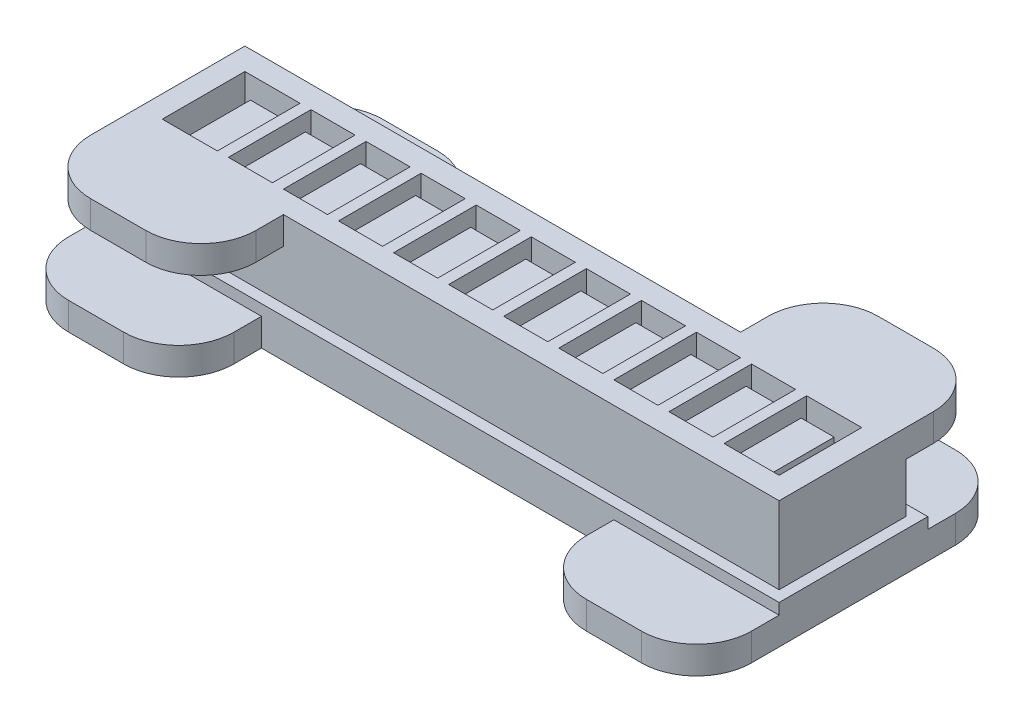
from build123d import *

# Parameters (mm, degrees)
SKETCH1_W                    = 8
SKETCH1_H                    = 15
FIRST_CHAMBER_BLOCK_DEPTH    = 15
SKETCH2_W                    = 6
SKETCH2_H                    = 11
FIRST_CHAMBER_CAVITY_DEPTH   = 13
SKETCH3_W                    = 15
SKETCH3_H                    = 3
CHAMBER_SPACER_DEPTH         = 2
PATTERN_CHAMBERS_COUNT       = 11
PATTERN_CHAMBERS_PITCH       = 10
SKETCH4_W                    = 15
SKETCH4_H                    = 12
THICKEN_END_1_DEPTH          = 2
SKETCH5_W                    = 15
SKETCH5_H                    = 15
THICKEN_END_2_DEPTH          = 2
SKETCH6_W                    = 94
SKETCH6_H                    = 2
CENTRAL_AIR_CHANNEL_DEPTH    = 2
SKETCH7_W                    = 108
SKETCH7_H                    = 13
SKETCH7_W_2                  = 106
SKETCH7_H_2                  = 11
BONDING_RIDGE_DEPTH          = 2
SKETCH9_W                    = 2
SKETCH9_H                    = 2.5
BONDING_BUMPS_DEPTH          = 2
PATTERN_BONDING_BUMPS_COUNT  = 10
PATTERN_BONDING_BUMPS_PITCH  = 10
SKETCH10_W                   = 120
SKETCH10_H                   = 23
ENCASING_BLOCK_DEPTH         = 21
SPLIT_START                  = 2
SPLIT_MOLD_DEPTH             = 11
SPLIT_START_2                = -4
SPLIT_MOLD_2_DEPTH           = 23
SPLIT_MOLD_3_OUTLINE_W       = 108
SPLIT_MOLD_3_OUTLINE_H       = 2
SPLIT_MOLD_3_DEPTH           = 5
SPLIT_START_3                = 14
SPLIT_MOLD_4_OUTLINE_W       = 108
SPLIT_MOLD_4_OUTLINE_H       = 2
SPLIT_MOLD_4_DEPTH           = 5
SPLIT_START_4                = 6.5
SPLIT_MOLD_5_DEPTH           = 2
SPLIT_START_5                = 5.5
SPLIT_MOLD_6_OUTLINE_W       = 2
SPLIT_MOLD_6_OUTLINE_H       = 2
SPLIT_MOLD_6_DEPTH           = 4
SPLIT_MOLD_7_OUTLINE_W       = 2
SPLIT_MOLD_7_OUTLINE_H       = 2
SPLIT_MOLD_7_DEPTH           = 1
SPLIT_START_6                = 12
SPLIT_MOLD_8_OUTLINE_W       = 2
SPLIT_MOLD_8_OUTLINE_H       = 2
SPLIT_MOLD_8_DEPTH           = 1
SPLIT_START_7                = -6
SPLIT_MOLD_9_OUTLINE_W       = 120
SPLIT_MOLD_9_OUTLINE_H       = 23
SPLIT_MOLD_9_DEPTH           = 6
SPLIT_MOLD_10_OUTLINE_W      = 6
SPLIT_MOLD_10_OUTLINE_H      = 11
SPLIT_MOLD_10_DEPTH          = 13
SPLIT_MOLD_11_OUTLINE_W      = 4
SPLIT_MOLD_11_OUTLINE_H      = 2
SPLIT_MOLD_11_DEPTH          = 2
SKETCH11_W                   = 30
SKETCH11_H                   = 5
GRIP_TAB_1_DEPTH             = 15
SKETCH12_W                   = 30
SKETCH12_H                   = 5
GRIP_TAB_2_DEPTH             = 15
FILLET_GRIP_TABS_R           = 10
SKETCH13_W                   = 124
SKETCH13_H                   = 27
SKETCH13_W_2                 = 120
SKETCH13_H_2                 = 23
BASE_MOLD_LIP_DEPTH          = 7
SKETCH14_W                   = 30
SKETCH14_H                   = 5
BASE_GRIP_TABS_1_AND_2_DEPTH = 15
SKETCH16_W                   = 30
SKETCH16_H                   = 5
BASE_GRIP_TABS_3_AND_4_DEPTH = 15
FILLET_BASE_GRIP_TABS_R      = 10


# Read off the part's stored shape, not the designer's step: split mold
with BuildPart() as part:
    # Sketch1 → first chamber block (new body)
    with BuildSketch(Plane.XY):
        with Locations((4, 7.5)):
            Rectangle(SKETCH1_W, SKETCH1_H)
    extrude(amount=FIRST_CHAMBER_BLOCK_DEPTH)

    # Sketch2 → first chamber cavity (cut)
    with BuildSketch(Plane.XZ):
        with Locations((4, 7.5)):
            Rectangle(SKETCH2_W, SKETCH2_H)
    extrude(amount=-FIRST_CHAMBER_CAVITY_DEPTH, mode=Mode.SUBTRACT)

    # Sketch3 → chamber spacer (add)
    with BuildSketch(Plane(origin=(8, 0, 0), x_dir=(0, 0, -1), z_dir=(1, 0, 0))):
        with Locations((-7.5, 1.5)):
            Rectangle(SKETCH3_W, SKETCH3_H)
    extrude(amount=CHAMBER_SPACER_DEPTH)


with BuildPart() as pattern_chambers_1:
    # pattern chambers: pattern copy
    add(part.part.moved(Location(Vector(1, 0, 0) * (1 * PATTERN_CHAMBERS_PITCH))))


with BuildPart() as pattern_chambers_2:
    # pattern chambers: pattern copy
    add(part.part.moved(Location(Vector(1, 0, 0) * (2 * PATTERN_CHAMBERS_PITCH))))


with BuildPart() as pattern_chambers_3:
    # pattern chambers: pattern copy
    add(part.part.moved(Location(Vector(1, 0, 0) * (3 * PATTERN_CHAMBERS_PITCH))))


with BuildPart() as pattern_chambers_4:
    # pattern chambers: pattern copy
    add(part.part.moved(Location(Vector(1, 0, 0) * (4 * PATTERN_CHAMBERS_PITCH))))


with BuildPart() as pattern_chambers_5:
    # pattern chambers: pattern copy
    add(part.part.moved(Location(Vector(1, 0, 0) * (5 * PATTERN_CHAMBERS_PITCH))))


with BuildPart() as pattern_chambers_6:
    # pattern chambers: pattern copy
    add(part.part.moved(Location(Vector(1, 0, 0) * (6 * PATTERN_CHAMBERS_PITCH))))


with BuildPart() as pattern_chambers_7:
    # pattern chambers: pattern copy
    add(part.part.moved(Location(Vector(1, 0, 0) * (7 * PATTERN_CHAMBERS_PITCH))))


with BuildPart() as pattern_chambers_8:
    # pattern chambers: pattern copy
    add(part.part.moved(Location(Vector(1, 0, 0) * (8 * PATTERN_CHAMBERS_PITCH))))


with BuildPart() as pattern_chambers_9:
    # pattern chambers: pattern copy
    add(part.part.moved(Location(Vector(1, 0, 0) * (9 * PATTERN_CHAMBERS_PITCH))))


with BuildPart() as pattern_chambers_10:
    # pattern chambers: pattern copy
    add(part.part.moved(Location(Vector(1, 0, 0) * (10 * PATTERN_CHAMBERS_PITCH))))

    # combine into 1 solid body: union pattern chambers_9, pattern chambers_8, pattern chambers_7, pattern chambers_6, pattern chambers_5, pattern chambers_4, pattern chambers_3, pattern chambers_2, pattern chambers_1, part
    add(pattern_chambers_9.part)
    add(pattern_chambers_8.part)
    add(pattern_chambers_7.part)
    add(pattern_chambers_6.part)
    add(pattern_chambers_5.part)
    add(pattern_chambers_4.part)
    add(pattern_chambers_3.part)
    add(pattern_chambers_2.part)
    add(pattern_chambers_1.part)
    add(part.part)

    # Sketch4 → thicken end 1 (add)
    with BuildSketch(Plane(origin=(108, 0, 0), x_dir=(0, 0, -1), z_dir=(1, 0, 0))):
        with Locations((-7.5, 9)):
            Rectangle(SKETCH4_W, SKETCH4_H)
    extrude(amount=THICKEN_END_1_DEPTH)

    # Sketch5 → thicken end 2 (add)
    with BuildSketch(Plane.ZY):
        with Locations((7.5, 7.5)):
            Rectangle(SKETCH5_W, SKETCH5_H)
    extrude(amount=THICKEN_END_2_DEPTH)

    # Sketch6 → central air channel (cut)
    with BuildSketch(Plane.XZ):
        with Locations((54, 7.5)):
            Rectangle(SKETCH6_W, SKETCH6_H)
    extrude(amount=-CENTRAL_AIR_CHANNEL_DEPTH, mode=Mode.SUBTRACT)

    # Sketch7 → bonding ridge (add)
    with BuildSketch(Plane.XZ):
        with Locations((54, 7.5)):
            Rectangle(SKETCH7_W, SKETCH7_H)
        with Locations((54, 7.5)):
            Rectangle(SKETCH7_W_2, SKETCH7_H_2, mode=Mode.SUBTRACT)
    extrude(amount=BONDING_RIDGE_DEPTH)

    # Sketch9 → bonding bumps (add)
    with BuildSketch(Plane.XZ):
        with Locations((9, 10.75)):
            Rectangle(SKETCH9_W, SKETCH9_H)
        with Locations((9, 4.25)):
            Rectangle(SKETCH9_W, SKETCH9_H)
    bonding_bumps = extrude(amount=BONDING_BUMPS_DEPTH)

    # pattern bonding bumps: bonding bumps ×10
    with Locations(*[(i * PATTERN_BONDING_BUMPS_PITCH, 0, 0) for i in range(1, PATTERN_BONDING_BUMPS_COUNT)]):
        add(bonding_bumps)


with BuildPart() as body_2:
    # Sketch10 → encasing block (new body)
    with BuildSketch(Plane(origin=(0, 15, 0), x_dir=(1, 0, 0), z_dir=(0, 1, 0))):
        with Locations((54, -7.5)):
            Rectangle(SKETCH10_W, SKETCH10_H)
    extrude(amount=-ENCASING_BLOCK_DEPTH)

    # subtract actuator: cut pattern chambers_10
    add(pattern_chambers_10.part, mode=Mode.SUBTRACT)

    # split mold 9 outline → split mold 9 (cut)
    with BuildSketch(Plane(origin=(0, 0, 0), x_dir=(1, 0, 0), z_dir=(0, 1, 0)).offset(SPLIT_START_7)):
        with Locations((54, -7.5)):
            Rectangle(SPLIT_MOLD_9_OUTLINE_W, SPLIT_MOLD_9_OUTLINE_H)
    extrude(amount=SPLIT_MOLD_9_DEPTH, mode=Mode.SUBTRACT)

    # split mold 10 outline → split mold 10 (cut)
    with BuildSketch(Plane(origin=(0, 0, 0), x_dir=(1, 0, 0), z_dir=(0, 1, 0))):
        with Locations((14, -7.5)):
            Rectangle(SPLIT_MOLD_10_OUTLINE_W, SPLIT_MOLD_10_OUTLINE_H)
        with Locations((4, -7.5)):
            Rectangle(SPLIT_MOLD_10_OUTLINE_W, SPLIT_MOLD_10_OUTLINE_H)
        with Locations((24, -7.5)):
            Rectangle(SPLIT_MOLD_10_OUTLINE_W, SPLIT_MOLD_10_OUTLINE_H)
        with Locations((34, -7.5)):
            Rectangle(SPLIT_MOLD_10_OUTLINE_W, SPLIT_MOLD_10_OUTLINE_H)
        with Locations((44, -7.5)):
            Rectangle(SPLIT_MOLD_10_OUTLINE_W, SPLIT_MOLD_10_OUTLINE_H)
        with Locations((54, -7.5)):
            Rectangle(SPLIT_MOLD_10_OUTLINE_W, SPLIT_MOLD_10_OUTLINE_H)
        with Locations((64, -7.5)):
            Rectangle(SPLIT_MOLD_10_OUTLINE_W, SPLIT_MOLD_10_OUTLINE_H)
        with Locations((74, -7.5)):
            Rectangle(SPLIT_MOLD_10_OUTLINE_W, SPLIT_MOLD_10_OUTLINE_H)
        with Locations((84, -7.5)):
            Rectangle(SPLIT_MOLD_10_OUTLINE_W, SPLIT_MOLD_10_OUTLINE_H)
        with Locations((94, -7.5)):
            Rectangle(SPLIT_MOLD_10_OUTLINE_W, SPLIT_MOLD_10_OUTLINE_H)
        with Locations((104, -7.5)):
            Rectangle(SPLIT_MOLD_10_OUTLINE_W, SPLIT_MOLD_10_OUTLINE_H)
    extrude(amount=SPLIT_MOLD_10_DEPTH, mode=Mode.SUBTRACT)

    # split mold 11 outline → split mold 11 (cut)
    with BuildSketch(Plane(origin=(0, 0, 0), x_dir=(1, 0, 0), z_dir=(0, 1, 0))):
        with Locations((9, -7.5)):
            Rectangle(SPLIT_MOLD_11_OUTLINE_W, SPLIT_MOLD_11_OUTLINE_H)
        with Locations((19, -7.5)):
            Rectangle(SPLIT_MOLD_11_OUTLINE_W, SPLIT_MOLD_11_OUTLINE_H)
        with Locations((29, -7.5)):
            Rectangle(SPLIT_MOLD_11_OUTLINE_W, SPLIT_MOLD_11_OUTLINE_H)
        with Locations((39, -7.5)):
            Rectangle(SPLIT_MOLD_11_OUTLINE_W, SPLIT_MOLD_11_OUTLINE_H)
        with Locations((49, -7.5)):
            Rectangle(SPLIT_MOLD_11_OUTLINE_W, SPLIT_MOLD_11_OUTLINE_H)
        with Locations((59, -7.5)):
            Rectangle(SPLIT_MOLD_11_OUTLINE_W, SPLIT_MOLD_11_OUTLINE_H)
        with Locations((69, -7.5)):
            Rectangle(SPLIT_MOLD_11_OUTLINE_W, SPLIT_MOLD_11_OUTLINE_H)
        with Locations((79, -7.5)):
            Rectangle(SPLIT_MOLD_11_OUTLINE_W, SPLIT_MOLD_11_OUTLINE_H)
        with Locations((89, -7.5)):
            Rectangle(SPLIT_MOLD_11_OUTLINE_W, SPLIT_MOLD_11_OUTLINE_H)
        with Locations((99, -7.5)):
            Rectangle(SPLIT_MOLD_11_OUTLINE_W, SPLIT_MOLD_11_OUTLINE_H)
    extrude(amount=SPLIT_MOLD_11_DEPTH, mode=Mode.SUBTRACT)

    # Sketch11 → grip tab 1 (add)
    with BuildSketch(Plane.XY.offset(19)):
        with Locations((9, 12.5)):
            Rectangle(SKETCH11_W, SKETCH11_H)
    extrude(amount=GRIP_TAB_1_DEPTH)

    # Sketch12 → grip tab 2 (add)
    with BuildSketch(Plane(origin=(0, 0, -4), x_dir=(-1, 0, 0), z_dir=(0, 0, -1))):
        with Locations((-99, 12.5)):
            Rectangle(SKETCH12_W, SKETCH12_H)
    extrude(amount=GRIP_TAB_2_DEPTH)

    # fillet grip tabs
    fillet_grip_tabs_edges = [body_2.edges().sort_by_distance(p)[0] for p in [
        (114, 12.5, -19),
        (84, 12.5, -19),
        (24, 12.5, 34),
        (-6, 12.5, 34),
    ]]
    fillet(fillet_grip_tabs_edges, radius=FILLET_GRIP_TABS_R)


with BuildPart() as body_2_2:
    # split mold outline → split mold (new body)
    with BuildSketch(Plane.XY.offset(SPLIT_START)):
        Polygon((7, 0), (7, 13), (1, 13), (1, -2), (0, -2), (0, 0), (-6, 0), (-6, -6), (114, -6), (114, 0), (108, 0), (108, -2), (107, -2), (107, 13), (101, 13), (101, 0), (100, 0), (100, -2), (98, -2), (98, 0), (97, 0), (97, 13), (91, 13), (91, 0), (90, 0), (90, -2), (88, -2), (88, 0), (87, 0), (87, 13), (81, 13), (81, 0), (80, 0), (80, -2), (78, -2), (78, 0), (77, 0), (77, 13), (71, 13), (71, 0), (70, 0), (70, -2), (68, -2), (68, 0), (67, 0), (67, 13), (61, 13), (61, 0), (60, 0), (60, -2), (58, -2), (58, 0), (57, 0), (57, 13), (51, 13), (51, 0), (50, 0), (50, -2), (48, -2), (48, 0), (47, 0), (47, 13), (41, 13), (41, 0), (40, 0), (40, -2), (38, -2), (38, 0), (37, 0), (37, 13), (31, 13), (31, 0), (30, 0), (30, -2), (28, -2), (28, 0), (27, 0), (27, 13), (21, 13), (21, 0), (20, 0), (20, -2), (18, -2), (18, 0), (17, 0), (17, 13), (11, 13), (11, 0), (10, 0), (10, -2), (8, -2), (8, 0), align=None)
    extrude(amount=SPLIT_MOLD_DEPTH)

    # split mold 2 outline → split mold 2 (add)
    with BuildSketch(Plane.XY.offset(SPLIT_START_2)):
        Polygon((108, -2), (0, -2), (0, 0), (-6, 0), (-6, -6), (114, -6), (114, 0), (108, 0), align=None)
    extrude(amount=SPLIT_MOLD_2_DEPTH)

    # split mold 3 outline → split mold 3 (add)
    with BuildSketch(Plane.XY.offset(SPLIT_START_2)):
        with Locations((54, -1)):
            Rectangle(SPLIT_MOLD_3_OUTLINE_W, SPLIT_MOLD_3_OUTLINE_H)
    extrude(amount=SPLIT_MOLD_3_DEPTH)

    # split mold 4 outline → split mold 4 (add)
    with BuildSketch(Plane.XY.offset(SPLIT_START_3)):
        with Locations((54, -1)):
            Rectangle(SPLIT_MOLD_4_OUTLINE_W, SPLIT_MOLD_4_OUTLINE_H)
    extrude(amount=SPLIT_MOLD_4_DEPTH)

    # split mold 5 outline → split mold 5 (add)
    with BuildSketch(Plane.XY.offset(SPLIT_START_4)):
        Polygon((11, 2), (7, 2), (7, 0), (8, 0), (8, -2), (10, -2), (10, 0), (11, 0), align=None)
        Polygon((17, 2), (17, 0), (18, 0), (18, -2), (20, -2), (20, 0), (21, 0), (21, 2), align=None)
        Polygon((27, 2), (27, 0), (28, 0), (28, -2), (30, -2), (30, 0), (31, 0), (31, 2), align=None)
        Polygon((38, 0), (38, -2), (40, -2), (40, 0), (41, 0), (41, 2), (37, 2), (37, 0), align=None)
        Polygon((100, 0), (101, 0), (101, 2), (97, 2), (97, 0), (98, 0), (98, -2), (100, -2), align=None)
        Polygon((48, 0), (48, -2), (50, -2), (50, 0), (51, 0), (51, 2), (47, 2), (47, 0), align=None)
        Polygon((58, 0), (58, -2), (60, -2), (60, 0), (61, 0), (61, 2), (57, 2), (57, 0), align=None)
        Polygon((88, -2), (90, -2), (90, 0), (91, 0), (91, 2), (87, 2), (87, 0), (88, 0), align=None)
        Polygon((68, 0), (68, -2), (70, -2), (70, 0), (71, 0), (71, 2), (67, 2), (67, 0), align=None)
        Polygon((78, -2), (80, -2), (80, 0), (81, 0), (81, 2), (77, 2), (77, 0), (78, 0), align=None)
    extrude(amount=SPLIT_MOLD_5_DEPTH)

    # split mold 6 outline → split mold 6 (add)
    with BuildSketch(Plane.XY.offset(SPLIT_START_5)):
        with Locations((9, -1)):
            Rectangle(SPLIT_MOLD_6_OUTLINE_W, SPLIT_MOLD_6_OUTLINE_H)
        with Locations((19, -1)):
            Rectangle(SPLIT_MOLD_6_OUTLINE_W, SPLIT_MOLD_6_OUTLINE_H)
        with Locations((29, -1)):
            Rectangle(SPLIT_MOLD_6_OUTLINE_W, SPLIT_MOLD_6_OUTLINE_H)
        with Locations((39, -1)):
            Rectangle(SPLIT_MOLD_6_OUTLINE_W, SPLIT_MOLD_6_OUTLINE_H)
        with Locations((49, -1)):
            Rectangle(SPLIT_MOLD_6_OUTLINE_W, SPLIT_MOLD_6_OUTLINE_H)
        with Locations((99, -1)):
            Rectangle(SPLIT_MOLD_6_OUTLINE_W, SPLIT_MOLD_6_OUTLINE_H)
        with Locations((59, -1)):
            Rectangle(SPLIT_MOLD_6_OUTLINE_W, SPLIT_MOLD_6_OUTLINE_H)
        with Locations((89, -1)):
            Rectangle(SPLIT_MOLD_6_OUTLINE_W, SPLIT_MOLD_6_OUTLINE_H)
        with Locations((69, -1)):
            Rectangle(SPLIT_MOLD_6_OUTLINE_W, SPLIT_MOLD_6_OUTLINE_H)
        with Locations((79, -1)):
            Rectangle(SPLIT_MOLD_6_OUTLINE_W, SPLIT_MOLD_6_OUTLINE_H)
    extrude(amount=SPLIT_MOLD_6_DEPTH)

    # split mold 7 outline → split mold 7 (add)
    with BuildSketch(Plane.XY.offset(SPLIT_START)):
        with Locations((9, -1)):
            Rectangle(SPLIT_MOLD_7_OUTLINE_W, SPLIT_MOLD_7_OUTLINE_H)
        with Locations((19, -1)):
            Rectangle(SPLIT_MOLD_7_OUTLINE_W, SPLIT_MOLD_7_OUTLINE_H)
        with Locations((29, -1)):
            Rectangle(SPLIT_MOLD_7_OUTLINE_W, SPLIT_MOLD_7_OUTLINE_H)
        with Locations((39, -1)):
            Rectangle(SPLIT_MOLD_7_OUTLINE_W, SPLIT_MOLD_7_OUTLINE_H)
        with Locations((49, -1)):
            Rectangle(SPLIT_MOLD_7_OUTLINE_W, SPLIT_MOLD_7_OUTLINE_H)
        with Locations((99, -1)):
            Rectangle(SPLIT_MOLD_7_OUTLINE_W, SPLIT_MOLD_7_OUTLINE_H)
        with Locations((59, -1)):
            Rectangle(SPLIT_MOLD_7_OUTLINE_W, SPLIT_MOLD_7_OUTLINE_H)
        with Locations((89, -1)):
            Rectangle(SPLIT_MOLD_7_OUTLINE_W, SPLIT_MOLD_7_OUTLINE_H)
        with Locations((69, -1)):
            Rectangle(SPLIT_MOLD_7_OUTLINE_W, SPLIT_MOLD_7_OUTLINE_H)
        with Locations((79, -1)):
            Rectangle(SPLIT_MOLD_7_OUTLINE_W, SPLIT_MOLD_7_OUTLINE_H)
    extrude(amount=SPLIT_MOLD_7_DEPTH)

    # split mold 8 outline → split mold 8 (add)
    with BuildSketch(Plane.XY.offset(SPLIT_START_6)):
        with Locations((9, -1)):
            Rectangle(SPLIT_MOLD_8_OUTLINE_W, SPLIT_MOLD_8_OUTLINE_H)
        with Locations((19, -1)):
            Rectangle(SPLIT_MOLD_8_OUTLINE_W, SPLIT_MOLD_8_OUTLINE_H)
        with Locations((29, -1)):
            Rectangle(SPLIT_MOLD_8_OUTLINE_W, SPLIT_MOLD_8_OUTLINE_H)
        with Locations((39, -1)):
            Rectangle(SPLIT_MOLD_8_OUTLINE_W, SPLIT_MOLD_8_OUTLINE_H)
        with Locations((49, -1)):
            Rectangle(SPLIT_MOLD_8_OUTLINE_W, SPLIT_MOLD_8_OUTLINE_H)
        with Locations((99, -1)):
            Rectangle(SPLIT_MOLD_8_OUTLINE_W, SPLIT_MOLD_8_OUTLINE_H)
        with Locations((59, -1)):
            Rectangle(SPLIT_MOLD_8_OUTLINE_W, SPLIT_MOLD_8_OUTLINE_H)
        with Locations((89, -1)):
            Rectangle(SPLIT_MOLD_8_OUTLINE_W, SPLIT_MOLD_8_OUTLINE_H)
        with Locations((69, -1)):
            Rectangle(SPLIT_MOLD_8_OUTLINE_W, SPLIT_MOLD_8_OUTLINE_H)
        with Locations((79, -1)):
            Rectangle(SPLIT_MOLD_8_OUTLINE_W, SPLIT_MOLD_8_OUTLINE_H)
    extrude(amount=SPLIT_MOLD_8_DEPTH)

    # Sketch13 → base mold lip (add)
    with BuildSketch(Plane.XZ.offset(6)):
        with Locations((54, 7.5)):
            Rectangle(SKETCH13_W, SKETCH13_H)
        with Locations((54, 7.5)):
            Rectangle(SKETCH13_W_2, SKETCH13_H_2, mode=Mode.SUBTRACT)
    extrude(amount=-BASE_MOLD_LIP_DEPTH)

    # Sketch14 → base grip tabs 1 and 2 (add)
    with BuildSketch(Plane.XY.offset(21)):
        with Locations((7, -3.5)):
            Rectangle(SKETCH14_W, SKETCH14_H)
        with Locations((101, -3.5)):
            Rectangle(SKETCH14_W, SKETCH14_H)
    extrude(amount=BASE_GRIP_TABS_1_AND_2_DEPTH)

    # Sketch16 → base grip tabs 3 and 4 (add)
    with BuildSketch(Plane(origin=(0, 0, -6), x_dir=(-1, 0, 0), z_dir=(0, 0, -1))):
        with Locations((-101, -3.5)):
            Rectangle(SKETCH16_W, SKETCH16_H)
        with Locations((-7, -3.5)):
            Rectangle(SKETCH16_W, SKETCH16_H)
    extrude(amount=BASE_GRIP_TABS_3_AND_4_DEPTH)

    # fillet base grip tabs
    fillet_base_grip_tabs_edges = [body_2_2.edges().sort_by_distance(p)[0] for p in [
        (116, -3.5, -21),
        (86, -3.5, -21),
        (22, -3.5, -21),
        (-8, -3.5, -21),
        (116, -3.5, 36),
        (86, -3.5, 36),
        (22, -3.5, 36),
        (-8, -3.5, 36),
    ]]
    fillet(fillet_base_grip_tabs_edges, radius=FILLET_BASE_GRIP_TABS_R)


solid = Compound([body_2.part, body_2_2.part])
